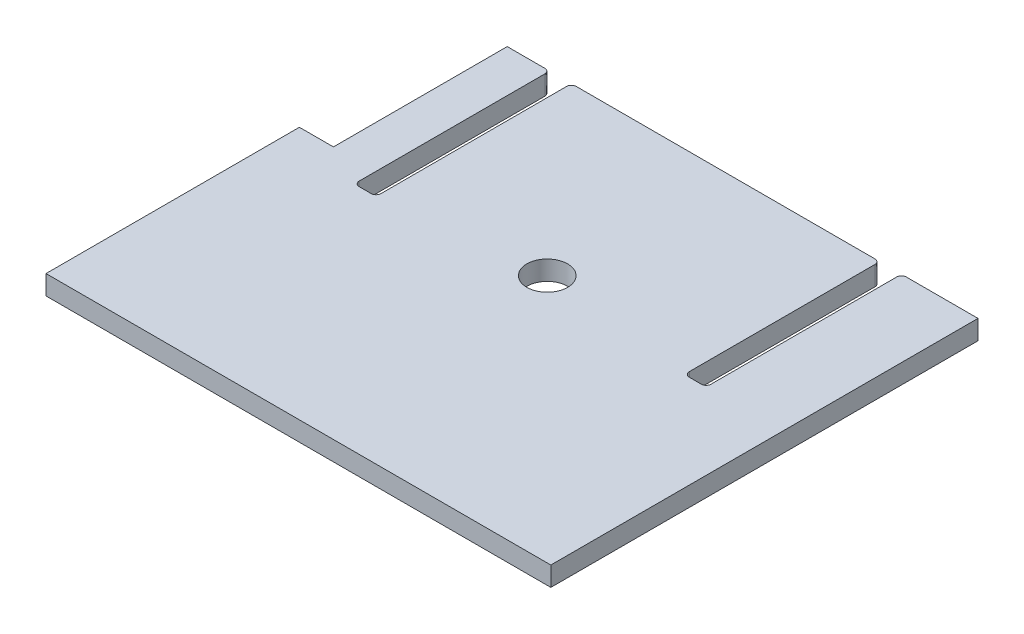
from build123d import *

# Parameters (mm, degrees)
BOSS_EXTRUDE1_DEPTH  = 6.35
CAVITY1_START        = 298.45
CAVITY1_OUTLINE_R    = 12.7
CAVITY1_DEPTH        = 12.7
CAVITY1_START_2      = 720.91620239
CAVITY1_2_DEPTH      = 22.43918751
SKETCH2_W            = 22.270177668
SKETCH2_H            = 113.672619585
CUT_EXTRUDE1_DEPTH   = 1143.349273427
MOVE_FACE_SLOTS_BY   = 0.762
MOVE_FACE_SLOTS_2_BY = 0.762
MOVE_FACE_SLOTS_3_BY = 0.762
MOVE_FACE_SLOTS_4_BY = 0.762
MOVE_FACE_SLOTS_5_BY = 0.762
MOVE_FACE_SLOTS_6_BY = 0.762
MOVE_FACE_HOLE_BY    = 0.635
SLOT_FILLET_R        = 3.175


# Read off the part's stored shape, not the designer's step: Cavity1
with BuildPart() as part:
    # Sketch1 → Boss-Extrude1 (new, symmetric)
    with BuildSketch(Plane(origin=(0, 304.8, 0), x_dir=(1, 0, 0), z_dir=(0, 1, 0))):
        Polygon((798.4, -133.35), (1001.6, -133.35), (1001.6, -260.35), (1014.3, -260.35), (1014.3, -133.35), (1065.1, -133.35), (1065.1, -412.75), (1014.3, -412.75), (1001.6, -412.75), (798.4, -412.75), (785.7, -412.75), (734.9, -412.75), (734.9, -133.35), (785.7, -133.35), (785.7, -260.35), (798.4, -260.35), align=None)
    extrude(amount=BOSS_EXTRUDE1_DEPTH, both=True)

    # Cavity1 outline → Cavity1 (cut)
    with BuildSketch(Plane(origin=(0, 0, 0), x_dir=(1, 0, 0), z_dir=(0, 1, 0)).offset(CAVITY1_START)):
        with Locations((900, -250)):
            Circle(CAVITY1_OUTLINE_R)
    extrude(amount=CAVITY1_DEPTH, mode=Mode.SUBTRACT)

    # Cavity1 2 outline → Cavity1 2 (cut)
    with BuildSketch(Plane(origin=(0, 0, 0), x_dir=(0.7149295353100829, -0.698752516444498, 0.02491345627949748), z_dir=(0.6991965099607612, 0.7144755512387372, -0.025474048378572107)).offset(CAVITY1_START_2)):
        with BuildLine():
            Line((312, -255.374549574), (314.076314529, -255.435688643))
            ThreePointArc((314.076314529, -255.435688643), (327.146171675, -242.424687318), (313.444242413, -230.081087528))
            Line((313.444242413, -230.081087528), (312, -230.195835843))
            Line((312, -230.195835843), (312, -255.374549574))
        make_face()
    extrude(amount=CAVITY1_2_DEPTH, mode=Mode.SUBTRACT)

    # Sketch2 → Cut-Extrude1 (cut, through all)
    with BuildSketch(Plane(origin=(0, 311.15, 0), x_dir=(1, 0, 0), z_dir=(0, 1, 0))):
        with Locations((746.035088834, -190.186309793)):
            Rectangle(SKETCH2_W, SKETCH2_H)
    extrude(amount=-CUT_EXTRUDE1_DEPTH, mode=Mode.SUBTRACT)

    # Move Face Slots: a face moved inward by 0.762
    extrude(part.faces().sort_by_distance((1014.3, 304.8, 196.85))[0], amount=MOVE_FACE_SLOTS_BY, dir=(1, 0, 0), mode=Mode.SUBTRACT)

    # Move Face Slots 2: a face moved inward by 0.762
    extrude(part.faces().sort_by_distance((1007.95, 304.8, 260.35))[0], amount=MOVE_FACE_SLOTS_2_BY, dir=(0, 0, 1), mode=Mode.SUBTRACT)

    # Move Face Slots 3: a face moved inward by 0.762
    extrude(part.faces().sort_by_distance((1001.6, 304.8, 196.85))[0], amount=MOVE_FACE_SLOTS_3_BY, dir=(-1, 0, 0), mode=Mode.SUBTRACT)

    # Move Face Slots 4: a face moved inward by 0.762
    extrude(part.faces().sort_by_distance((785.7, 304.8, 196.85))[0], amount=MOVE_FACE_SLOTS_4_BY, dir=(-1, 0, 0), mode=Mode.SUBTRACT)

    # Move Face Slots 5: a face moved inward by 0.762
    extrude(part.faces().sort_by_distance((792.05, 304.8, 260.35))[0], amount=MOVE_FACE_SLOTS_5_BY, dir=(0, 0, 1), mode=Mode.SUBTRACT)

    # Move Face Slots 6: a face moved inward by 0.762
    extrude(part.faces().sort_by_distance((798.4, 304.8, 196.85))[0], amount=MOVE_FACE_SLOTS_6_BY, dir=(1, 0, 0), mode=Mode.SUBTRACT)

    # Move Face Hole: a curved face moved inward by 0.635
    add(Solid.thicken(part.faces().sort_by_distance((887.3, 304.8, 250))[0], -MOVE_FACE_HOLE_BY), mode=Mode.SUBTRACT)

    # Slot Fillet
    slot_fillet_edges = [part.edges().sort_by_distance(p)[0] for p in [
        (1015.062, 304.8, 133.35),
        (1015.062, 304.8, 261.112),
        (1000.838, 304.8, 261.112),
        (1000.838, 304.8, 133.35),
        (799.162, 304.8, 133.35),
        (799.162, 304.8, 261.112),
        (784.938, 304.8, 261.112),
        (784.938, 304.8, 133.35),
    ]]
    fillet(slot_fillet_edges, radius=SLOT_FILLET_R)


solid = part.part
